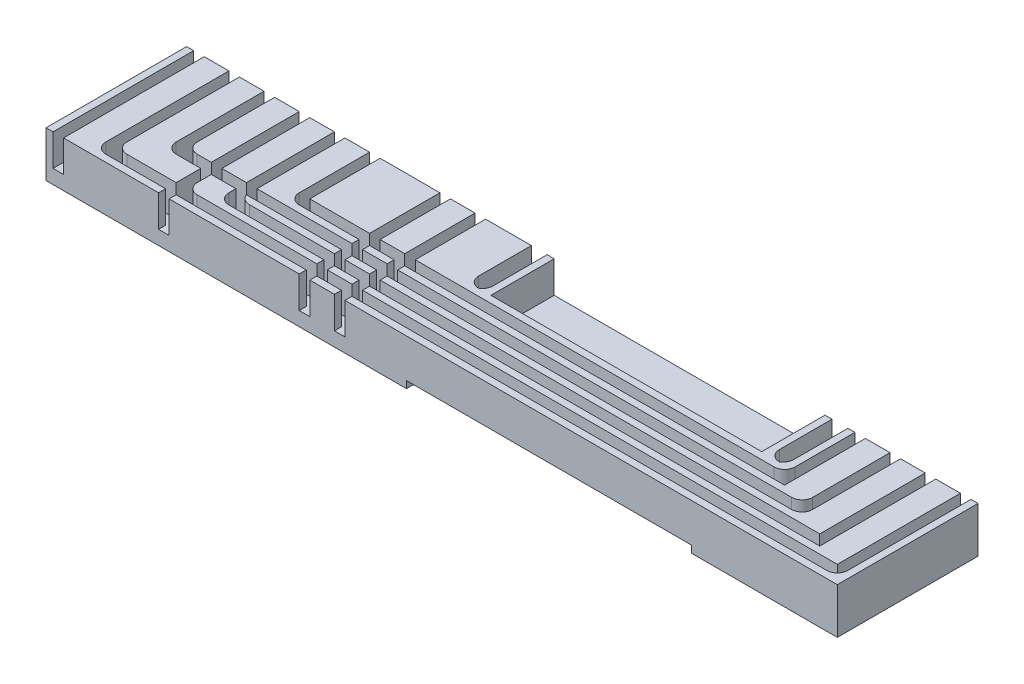
from build123d import *

# Parameters (mm, degrees)
PROFILESKETCH1_W              = 225
PROFILESKETCH1_H              = 40
PROFILEBOSS_EXTRUDE1_DEPTH    = 13
CABLE_GUIDESSKETCH2_W         = 27
CABLE_GUIDESSKETCH2_H         = 2
CABLE_GUIDESSKETCH2_W_2       = 7
CABLE_GUIDESSKETCH2_W_3       = 3
CABLE_GUIDESSKETCH2_H_2       = 40
CABLE_GUIDESSKETCH2_W_4       = 4.5
CABLE_GUIDESSKETCH2_H_3       = 18
CABLE_GUIDESSKETCH2_W_5       = 77
CABLEGUIDESCUT_EXTRUDE1_DEPTH = 9
FILLET3_R                     = 3
FILLET5_R                     = 3
FILLET6_R                     = 3
FILLET7_R                     = 3
BRIDGESKETCH2_W               = 81
BRIDGESKETCH2_H               = 2
BRIDGECUT_EXTRUDE3_DEPTH      = 229.897356909
MOUNTHOLESSKETCH4_R           = 1.592048555
MOUNTHOLESSKETCH4_R_2         = 1.651770992
MOUNTHOLESCUT_EXTRUDE4_DEPTH  = 229.705050228


with BuildPart() as part:
    # ProfileSketch1 → ProfileBoss-Extrude1 (new body)
    with BuildSketch(Plane(origin=(0, 0, 0), x_dir=(1, 0, 0), z_dir=(0, 1, 0))):
        with Locations((112.5, 20)):
            Rectangle(PROFILESKETCH1_W, PROFILESKETCH1_H)
    extrude(amount=PROFILEBOSS_EXTRUDE1_DEPTH)

    # Cable GuidesSketch2 → CableGuidesCut-Extrude1 (cut)
    # profile 1 of 5: a face of its own
    with BuildSketch(Plane(origin=(0, 13, 0), x_dir=(1, 0, 0), z_dir=(0, 1, 0))):
        Polygon((223, 2), (85, 2), (85, 0), (82, 0), (82, 2), (75, 2), (75, 0), (72, 0), (72, 2), (35, 2), (35, 0), (32, 0), (32, 2), (12, 2), (12, 40), (15, 40), (15, 5), (32, 5), (32, 12), (22, 12), (22, 40), (25, 40), (25, 15), (32, 15), (32, 40), (35, 40), (35, 15), (42, 15), (42, 40), (45, 40), (45, 15), (72, 15), (72, 17), (52, 17), (52, 40), (55, 40), (55, 20), (72, 20), (72, 40), (75, 40), (75, 20), (82, 20), (82, 40), (85, 40), (85, 20), (190, 20), (190, 40), (193, 40), (193, 17), (85, 17), (85, 15), (200, 15), (200, 40), (203, 40), (203, 12), (85, 12), (85, 10), (210, 10), (210, 40), (213, 40), (213, 7), (85, 7), (85, 5), (220, 5), (220, 40), (223, 40), align=None)
        Polygon((42, 7), (72, 7), (72, 5), (35, 5), (35, 12), (42, 12), align=None, mode=Mode.SUBTRACT)
        with Locations((58.5, 11)):
            Rectangle(CABLE_GUIDESSKETCH2_W, CABLE_GUIDESSKETCH2_H, mode=Mode.SUBTRACT)
        with Locations((78.5, 16)):
            Rectangle(CABLE_GUIDESSKETCH2_W_2, CABLE_GUIDESSKETCH2_H, mode=Mode.SUBTRACT)
        with Locations((78.5, 11)):
            Rectangle(CABLE_GUIDESSKETCH2_W_2, CABLE_GUIDESSKETCH2_H, mode=Mode.SUBTRACT)
        with Locations((78.5, 6)):
            Rectangle(CABLE_GUIDESSKETCH2_W_2, CABLE_GUIDESSKETCH2_H, mode=Mode.SUBTRACT)
    # profile 2 of 5: a face of its own
    with BuildSketch(Plane(origin=(0, 13, 0), x_dir=(1, 0, 0), z_dir=(0, 1, 0))):
        with Locations((3.5, 20)):
            Rectangle(CABLE_GUIDESSKETCH2_W_3, CABLE_GUIDESSKETCH2_H_2)
    # profile 3 of 5: a face of its own
    with BuildSketch(Plane(origin=(0, 13, 0), x_dir=(1, 0, 0), z_dir=(0, 1, 0))):
        with Locations((100.25, 31)):
            Rectangle(CABLE_GUIDESSKETCH2_W_4, CABLE_GUIDESSKETCH2_H_3)
    # profile 4 of 5: a face of its own
    with BuildSketch(Plane(origin=(0, 13, 0), x_dir=(1, 0, 0), z_dir=(0, 1, 0))):
        with Locations((185.75, 31)):
            Rectangle(CABLE_GUIDESSKETCH2_W_4, CABLE_GUIDESSKETCH2_H_3)
    # profile 5 of 5: a face of its own
    with BuildSketch(Plane(origin=(0, 13, 0), x_dir=(1, 0, 0), z_dir=(0, 1, 0))):
        with Locations((143, 31)):
            Rectangle(CABLE_GUIDESSKETCH2_W_5, CABLE_GUIDESSKETCH2_H_3)
    extrude(amount=-CABLEGUIDESCUT_EXTRUDE1_DEPTH, mode=Mode.SUBTRACT)

    # Fillet3
    fillet3_edges = [part.edges().sort_by_distance(p)[0] for p in [
        (183.5, 8.5, -22),
        (12, 8.5, -2),
        (22, 8.5, -12),
        (52, 8.5, -17),
        (42, 8.5, -7),
        (98, 8.5, -22),
    ]]
    fillet(fillet3_edges, radius=FILLET3_R)

    # Fillet5
    # the kernel refuses this fillet: 3 mm, written as the material it adds along each edge
    with BuildSketch(Plane(origin=(188, 13, -22), x_dir=(0, 0, -1), z_dir=(0, -1, 0)), Plane(origin=(102.5, 13, -22), x_dir=(0, 0, -1), z_dir=(0, -1, 0))) as fillet5_piece_1:
        with BuildLine():
            CenterArc((2.598076211, -3), FILLET5_R, 90, 60)
            Line((0, -1.5), (0, 0))
            Line((0, 0), (2.598076211, 0))
        make_face()
    extrude(amount=9)
    # the kernel refuses this fillet: 3 mm, written as the material it takes off along each edge
    with BuildSketch(Plane(origin=(200, 20.5, -15), x_dir=(0, 0, -1), z_dir=(0, -1, 0)), Plane(origin=(190, 20.5, -20), x_dir=(0, 0, -1), z_dir=(0, -1, 0))) as fillet5_2_piece_1:
        with BuildLine():
            CenterArc((FILLET5_R, -FILLET5_R), FILLET5_R, 90, 90)
            Line((0, -FILLET5_R), (0, 0))
            Line((0, 0), (FILLET5_R, 0))
        make_face()
    extrude(amount=16.5, mode=Mode.SUBTRACT)

    # Fillet6
    fillet6_edges = [part.edges().sort_by_distance(p)[0] for p in [
        (223, 8.5, -2),
        (203, 8.5, -12),
    ]]
    fillet(fillet6_edges, radius=FILLET6_R)

    # Fillet7
    # the kernel refuses this fillet: 3 mm, written as the material it takes off along each edge
    with BuildSketch(Plane(origin=(35, 20.5, -5), x_dir=(0, 0, -1), z_dir=(0, -1, 0)), Plane(origin=(15, 20.5, -5), x_dir=(0, 0, -1), z_dir=(0, -1, 0)), Plane(origin=(25, 20.5, -15), x_dir=(0, 0, -1), z_dir=(0, -1, 0))) as fillet7_piece_1:
        with BuildLine():
            CenterArc((FILLET7_R, FILLET7_R), FILLET7_R, 180, 90)
            Line((0, FILLET7_R), (-FILLET7_R * 0.02, FILLET7_R))
            Line((-FILLET7_R * 0.02, FILLET7_R), (-FILLET7_R * 0.02, -FILLET7_R * 0.02))
            Line((-FILLET7_R * 0.02, -FILLET7_R * 0.02), (FILLET7_R, -FILLET7_R * 0.02))
            Line((FILLET7_R, -FILLET7_R * 0.02), (FILLET7_R, 0))
        make_face()
    extrude(amount=16.5, mode=Mode.SUBTRACT)
    with BuildSketch(Plane(origin=(45, 20.071067812, -10), x_dir=(1, 0, 0), z_dir=(0, -1, 0))) as fillet7_piece_2:
        with BuildLine():
            CenterArc((2.828427125, -3), FILLET7_R, 90, 70.528779366)
            Line((0, -2), (-0.056568542, -1.98))
            ThreePointArc((-0.056568542, -1.98), (-0.06, -1), (-0.06, 0))
            Line((-0.06, 0), (0, 0.06))
            Line((0, 0.06), (2.828427125, 0.06))
            Line((2.828427125, 0.06), (2.828427125, 0))
        make_face()
    extrude(amount=16.071067812, mode=Mode.SUBTRACT)

    # BridgeSketch2 → BridgeCut-Extrude3 (cut, through all)
    with BuildSketch(Plane.XY):
        with Locations((143, 1)):
            Rectangle(BRIDGESKETCH2_W, BRIDGESKETCH2_H)
    extrude(amount=-BRIDGECUT_EXTRUDE3_DEPTH, mode=Mode.SUBTRACT)

    # MountHolesSketch4 → MountHolesCut-Extrude4 (cut, through all)
    with BuildSketch(Plane(origin=(0, 4, 0), x_dir=(1, 0, 0), z_dir=(0, 1, 0))):
        with Locations(Location((100.25, 30.227770246, 0), (0, 0, 270))):
            Circle(MOUNTHOLESSKETCH4_R)
        with Locations(Location((185.75, 30, 0), (0, 0, 270))):
            Circle(MOUNTHOLESSKETCH4_R_2)
    extrude(amount=-MOUNTHOLESCUT_EXTRUDE4_DEPTH, mode=Mode.SUBTRACT)


solid = part.part
